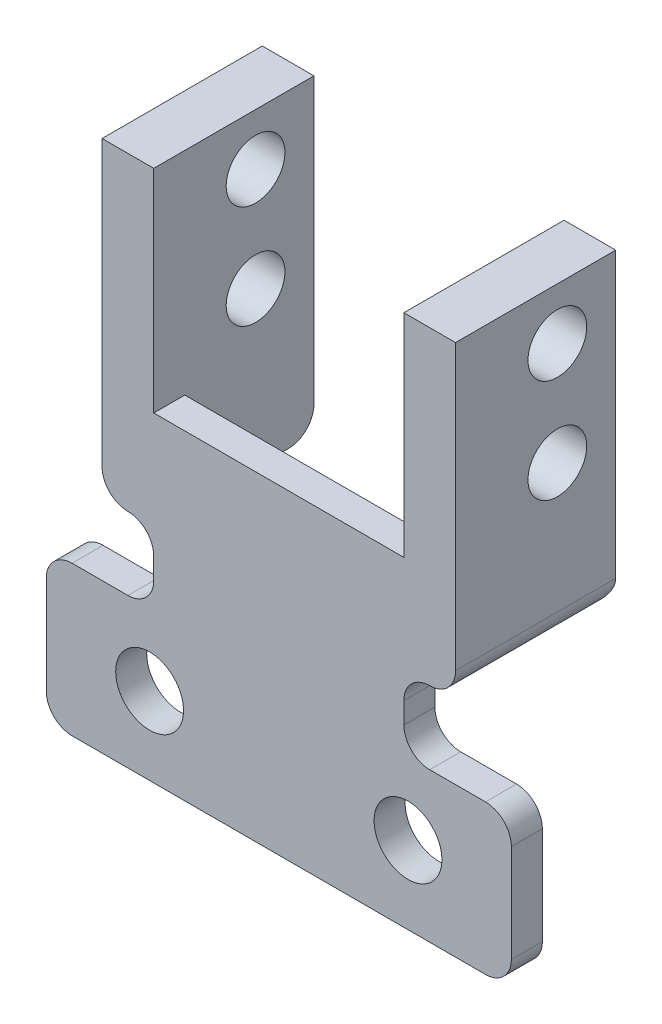
from build123d import *

# Parameters (mm, degrees)
SKETCH1_W                        = 45
SKETCH1_H                        = 14.46
BOSS_EXTRUDE1_DEPTH              = 3
F_1_4_0_2584625_DIAMETER_HOLE1_D = 6.5649475
SKETCH5_W                        = 24.2
SKETCH5_H                        = 37.04
BOSS_EXTRUDE2_DEPTH              = 3
SKETCH6_W                        = 15.5
SKETCH6_H                        = 30
BOSS_EXTRUDE3_DEPTH              = 5
BOSS_EXTRUDE4_START              = -29.2
SKETCH7_W                        = 15.5
SKETCH7_H                        = 30
BOSS_EXTRUDE4_DEPTH              = 5
SKETCH12_W                       = 24.2
SKETCH12_H                       = 20.5
CUT_EXTRUDE1_DEPTH               = 3
M5_CLEARANCE_HOLE1_D             = 5.686175
FILLET3_R                        = 2.5
FILLET4_R                        = 2.5


with BuildPart() as part:
    # Sketch1 → Boss-Extrude1 (new body)
    with BuildSketch(Plane.XY):
        with Locations((13.988651535, -1.802042724)):
            Rectangle(SKETCH1_W, SKETCH1_H)
    extrude(amount=BOSS_EXTRUDE1_DEPTH)

    # 1/4 (0.2584625) Diameter Hole1 (through all)
    with Locations(Plane(origin=(0, 0, 0), x_dir=(-1, 0, 0), z_dir=(0, 0, -1))):
        with Locations((-26.488651535, -1.532042724), (-1.488651535, -1.532042724)):
            Hole(F_1_4_0_2584625_DIAMETER_HOLE1_D / 2)

    # Sketch5 → Boss-Extrude2 (add)
    with BuildSketch(Plane(origin=(0, 0, 0), x_dir=(-1, 0, 0), z_dir=(0, 0, -1))):
        with Locations((-13.988651535, 23.947957276)):
            Rectangle(SKETCH5_W, SKETCH5_H)
    extrude(amount=-BOSS_EXTRUDE2_DEPTH)

    # Sketch6 → Boss-Extrude3 (add)
    with BuildSketch(Plane.ZY.offset(-1.888651535)):
        with Locations((-4.75, 27.467957276)):
            Rectangle(SKETCH6_W, SKETCH6_H)
    extrude(amount=BOSS_EXTRUDE3_DEPTH)

    # Sketch7 → Boss-Extrude4 (add)
    with BuildSketch(Plane.ZY.offset(3.111348465).offset(BOSS_EXTRUDE4_START)):
        with Locations((-4.75, 27.467957276)):
            Rectangle(SKETCH7_W, SKETCH7_H)
    extrude(amount=-BOSS_EXTRUDE4_DEPTH)

    # Sketch12 → Cut-Extrude1 (cut)
    with BuildSketch(Plane(origin=(0, 0, 0), x_dir=(-1, 0, 0), z_dir=(0, 0, -1))):
        with Locations((-13.988651535, 32.217957276)):
            Rectangle(SKETCH12_W, SKETCH12_H)
    extrude(amount=-CUT_EXTRUDE1_DEPTH, mode=Mode.SUBTRACT)

    # M5 Clearance Hole1 (through all)
    with Locations(Plane.ZY.offset(3.111348465)):
        with Locations((-6.85, 37.467957276), (-6.85, 27.467957276)):
            Hole(M5_CLEARANCE_HOLE1_D / 2)

    # Fillet3
    fillet3_edges = [part.edges().sort_by_distance(p)[0] for p in [
        (-8.511348465, 5.427957276, 1.5),
        (36.488651535, 5.427957276, 1.5),
        (36.488651535, -9.032042724, 1.5),
        (-8.511348465, -9.032042724, 1.5),
    ]]
    fillet(fillet3_edges, radius=FILLET3_R)

    # Fillet4
    fillet4_edges = [part.edges().sort_by_distance(p)[0] for p in [
        (1.888651535, 5.427957276, 1.5),
        (26.088651535, 5.427957276, 1.5),
        (26.088651535, 12.467957276, 1.5),
        (1.888651535, 12.467957276, 1.5),
        (31.088651535, 12.467957276, -4.75),
        (-3.111348465, 12.467957276, -4.75),
        (28.588651535, 12.467957276, -12.5),
        (-0.611348465, 12.467957276, -12.5),
    ]]
    fillet(fillet4_edges, radius=FILLET4_R - 0.0001)  # a hair under: the kernel refuses the full size


solid = part.part
